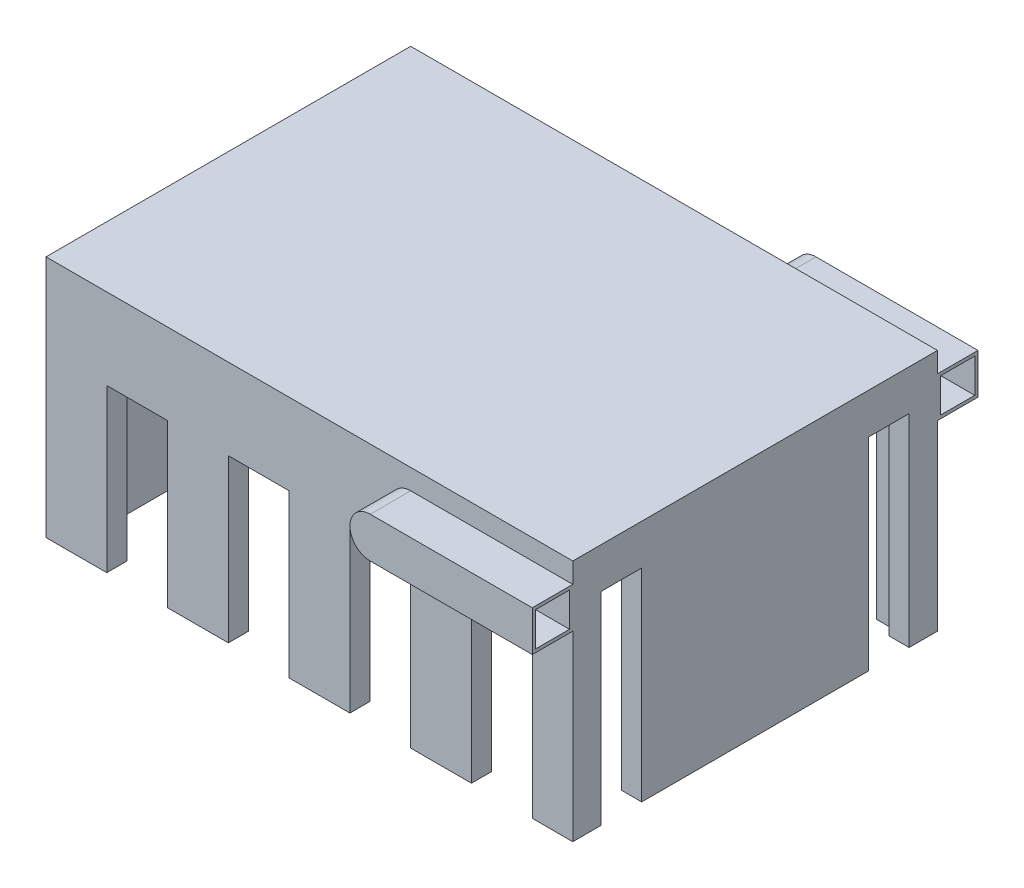
from build123d import *

# Parameters (mm, degrees)
SKETCH1_W           = 13
SKETCH1_H           = 9
BOSS_EXTRUDE1_DEPTH = 6
SHELL9_START        = -6
SHELL9_OUTLINE_W    = 5.5
SHELL9_OUTLINE_H    = 8
SHELL9_DEPTH        = 12
SKETCH2_W           = 1.5
SKETCH2_H           = 4
CUT_EXTRUDE2_DEPTH  = 13.619429464
BOSS_EXTRUDE2_DEPTH = 1
CUT_EXTRUDE3_DEPTH  = 1
SKETCH6_W           = 0.84
SKETCH6_H           = 0.84
CUT_EXTRUDE4_DEPTH  = 3.9
SKETCH7_R           = 0.15
CUT_EXTRUDE6_DEPTH  = 9.9
SKETCH9_W           = 1
SKETCH9_H           = 5
CUT_EXTRUDE7_DEPTH  = 0.8


# Read off the part's stored shape, not the designer's step: Shell9
with BuildPart() as part:
    # Sketch1 → Boss-Extrude1 (new body)
    with BuildSketch(Plane(origin=(0, 0, 0), x_dir=(1, 0, 0), z_dir=(0, 1, 0))):
        Rectangle(SKETCH1_W, SKETCH1_H)
    extrude(amount=BOSS_EXTRUDE1_DEPTH)

    # Shell9 outline → Shell9 (cut)
    with BuildSketch(Plane.YZ.offset(SHELL9_START)):
        with Locations((2.75, 0)):
            Rectangle(SHELL9_OUTLINE_W, SHELL9_OUTLINE_H)
    extrude(amount=SHELL9_DEPTH, mode=Mode.SUBTRACT)

    # Sketch2 → Cut-Extrude2 (cut, through all)
    with BuildSketch(Plane.XY.offset(4.5)):
        with Locations((-1.25, 2)):
            Rectangle(SKETCH2_W, SKETCH2_H)
        with Locations((-4.25, 2)):
            Rectangle(SKETCH2_W, SKETCH2_H)
        with Locations((1.75, 2)):
            Rectangle(SKETCH2_W, SKETCH2_H)
        with Locations((4.75, 2)):
            Rectangle(SKETCH2_W, SKETCH2_H)
    extrude(amount=-CUT_EXTRUDE2_DEPTH, mode=Mode.SUBTRACT)

    # Sketch3 → Boss-Extrude2 (add)
    with BuildSketch(Plane.XY.offset(4.5)):
        with BuildLine():
            Line((2.5, 4.5), (10.5, 4.5))
            ThreePointArc((10.5, 4.5), (11, 5), (10.5, 5.5))
            Line((10.5, 5.5), (2.5, 5.5))
            ThreePointArc((2.5, 5.5), (2, 5), (2.5, 4.5))
        make_face()
    boss_extrude2 = extrude(amount=BOSS_EXTRUDE2_DEPTH)

    # Sketch5 → Cut-Extrude3 (cut)
    with BuildSketch(Plane(origin=(0, 0, 4.5), x_dir=(-1, 0, 0), z_dir=(0, 0, -1))):
        with BuildLine():
            Line((-10.5, 5.5), (-6.5, 5.5))
            Line((-6.5, 5.5), (-6.5, 4.5))
            Line((-6.5, 4.5), (-10.5, 4.5))
            ThreePointArc((-10.5, 4.5), (-11, 5), (-10.5, 5.5))
        make_face()
    cut_extrude3 = extrude(amount=-CUT_EXTRUDE3_DEPTH, mode=Mode.SUBTRACT)

    # Sketch6 → Cut-Extrude4 (cut)
    with BuildSketch(Plane(origin=(6.5, 0, 0), x_dir=(0, 0, -1), z_dir=(1, 0, 0))):
        with Locations((-5, 5)):
            Rectangle(SKETCH6_W, SKETCH6_H)
    cut_extrude4 = extrude(amount=-CUT_EXTRUDE4_DEPTH, mode=Mode.SUBTRACT)

    # Mirror1: Boss-Extrude2, Cut-Extrude3, Cut-Extrude4 across plane
    add(boss_extrude2.mirror(Plane.XY))
    add(cut_extrude3.mirror(Plane.XY), mode=Mode.SUBTRACT)
    add(cut_extrude4.mirror(Plane.XY), mode=Mode.SUBTRACT)

    # Sketch7 → Cut-Extrude6 (cut)
    with BuildSketch(Plane.XY.offset(4.58)):
        with Locations((5.75, 5.050831707)):
            Circle(SKETCH7_R)
    extrude(amount=-CUT_EXTRUDE6_DEPTH, mode=Mode.SUBTRACT)

    # Sketch9 → Cut-Extrude7 (cut)
    with BuildSketch(Plane(origin=(6.5, 0, 0), x_dir=(0, 0, -1), z_dir=(1, 0, 0))):
        with Locations((-3.3, 2.5)):
            Rectangle(SKETCH9_W, SKETCH9_H)
        with Locations((3.3, 2.5)):
            Rectangle(SKETCH9_W, SKETCH9_H)
    extrude(amount=-CUT_EXTRUDE7_DEPTH, mode=Mode.SUBTRACT)


solid = part.part
